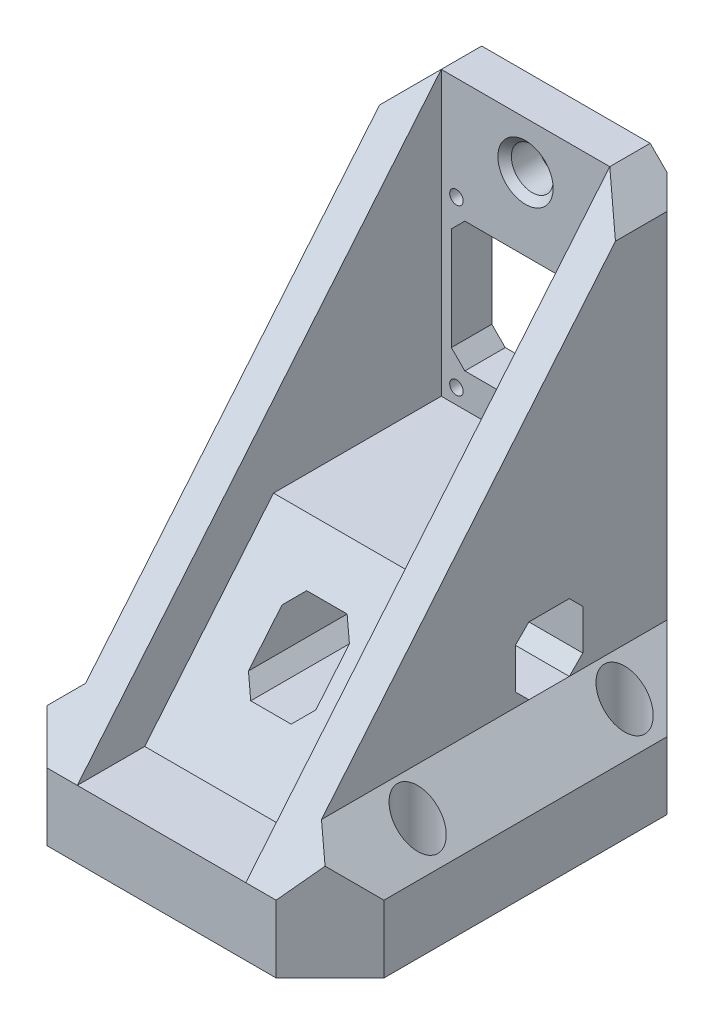
from build123d import *

# Parameters (mm, degrees)
SKETCH1_W           = 50
SKETCH1_H           = 60
BOSS_EXTRUDE1_DEPTH = 10
SKETCH2_R           = 1.5
CUT_EXTRUDE1_DEPTH  = 6
CUT_EXTRUDE2_REACH  = 41.509
SKETCH3_R           = 3
SKETCH5_W           = 25
SKETCH5_H           = 6
BOSS_EXTRUDE3_DEPTH = 65
CUT_EXTRUDE3_REACH  = 101.247
SKETCH6_W           = 22
SKETCH6_H           = 19.25
SKETCH7_R           = 1
CUT_EXTRUDE4_DEPTH  = 2.5
CUT_EXTRUDE5_REACH  = 99.171
SKETCH8_R           = 2
BOSS_EXTRUDE4_DEPTH = 5
CHAMFER1_SIZE       = 7.5
CHAMFER2_SIZE       = 10
CHAMFER4_SIZE       = 5.5
CHAMFER5_SIZE       = 5
CHAMFER7_SIZE       = 2
CUT_EXTRUDE6_REACH  = 101.247
SKETCH10_R          = 3.1
CHAMFER8_SIZE       = 1
BOSS_EXTRUDE5_REACH = 91.058
CHAMFER9_SIZE       = 8
CUT_EXTRUDE7_REACH  = 101.247
SKETCH12_W          = 10
SKETCH12_H          = 10
CUT_EXTRUDE9_REACH  = 88.168
SKETCH14_W          = 10
SKETCH14_H          = 10
CHAMFER11_SIZE      = 2


with BuildPart() as part:
    # Sketch1 → Boss-Extrude1 (new body)
    with BuildSketch(Plane(origin=(0, 0, 0), x_dir=(1, 0, 0), z_dir=(0, 1, 0))):
        Rectangle(SKETCH1_W, SKETCH1_H)
    extrude(amount=BOSS_EXTRUDE1_DEPTH)

    # Sketch2 → Cut-Extrude1 (cut)
    with BuildSketch(Plane(origin=(0, 0, 0), x_dir=(1, 0, 0), z_dir=(0, 1, 0))):
        with Locations(Location((-21, 17.7, 0), (0, 0, 270))):
            Circle(SKETCH2_R)
        with Locations(Location((-21, -13, 0), (0, 0, 270))):
            Circle(SKETCH2_R)
        with Locations(Location((21, 17.7, 0), (0, 0, 270))):
            Circle(SKETCH2_R)
        with Locations(Location((21, -13, 0), (0, 0, 270))):
            Circle(SKETCH2_R)
    extrude(amount=CUT_EXTRUDE1_DEPTH, mode=Mode.SUBTRACT)

    # Sketch3 → Cut-Extrude2 (cut, up to next)
    with BuildSketch(Plane.XZ.offset(-6), mode=Mode.PRIVATE) as cut_extrude2_sk1:
        with Locations(Location((-21, 13, 0), (0, 0, 270))):
            Circle(SKETCH3_R)
    cut_extrude2_tool1 = extrude(cut_extrude2_sk1.sketch, amount=-CUT_EXTRUDE2_REACH, mode=Mode.PRIVATE) & part.part
    # Sketch3 → Cut-Extrude2 (cut, up to next)
    with BuildSketch(Plane.XZ.offset(-6), mode=Mode.PRIVATE) as cut_extrude2_sk2:
        with Locations(Location((21, 13, 0), (0, 0, 270))):
            Circle(SKETCH3_R)
    cut_extrude2_tool2 = extrude(cut_extrude2_sk2.sketch, amount=-CUT_EXTRUDE2_REACH, mode=Mode.PRIVATE) & part.part
    # Sketch3 → Cut-Extrude2 (cut, up to next)
    with BuildSketch(Plane.XZ.offset(-6), mode=Mode.PRIVATE) as cut_extrude2_sk3:
        with Locations(Location((21, -17.7, 0), (0, 0, 270))):
            Circle(SKETCH3_R)
    cut_extrude2_tool3 = extrude(cut_extrude2_sk3.sketch, amount=-CUT_EXTRUDE2_REACH, mode=Mode.PRIVATE) & part.part
    # Sketch3 → Cut-Extrude2 (cut, up to next)
    with BuildSketch(Plane.XZ.offset(-6), mode=Mode.PRIVATE) as cut_extrude2_sk4:
        with Locations(Location((-21, -17.7, 0), (0, 0, 270))):
            Circle(SKETCH3_R)
    cut_extrude2_tool4 = extrude(cut_extrude2_sk4.sketch, amount=-CUT_EXTRUDE2_REACH, mode=Mode.PRIVATE) & part.part
    add(cut_extrude2_tool1.solids().sort_by_distance((-21, 6, 13))[0], mode=Mode.SUBTRACT)
    add(cut_extrude2_tool2.solids().sort_by_distance((21, 6, 13))[0], mode=Mode.SUBTRACT)
    add(cut_extrude2_tool3.solids().sort_by_distance((21, 6, -17.7))[0], mode=Mode.SUBTRACT)
    add(cut_extrude2_tool4.solids().sort_by_distance((-21, 6, -17.7))[0], mode=Mode.SUBTRACT)

    # Sketch5 → Boss-Extrude3 (add)
    with BuildSketch(Plane(origin=(0, 10, 0), x_dir=(1, 0, 0), z_dir=(0, 1, 0))):
        with Locations((0, 27)):
            Rectangle(SKETCH5_W, SKETCH5_H)
    extrude(amount=BOSS_EXTRUDE3_DEPTH)

    # Sketch6 → Cut-Extrude3 (cut, up to next)
    with BuildSketch(Plane(origin=(0, 0, -30), x_dir=(-1, 0, 0), z_dir=(0, 0, -1)), mode=Mode.PRIVATE) as cut_extrude3_sk1:
        with Locations((0, 47.625)):
            Rectangle(SKETCH6_W, SKETCH6_H)
    cut_extrude3_tool1 = extrude(cut_extrude3_sk1.sketch, amount=-CUT_EXTRUDE3_REACH, mode=Mode.PRIVATE) & part.part
    add(cut_extrude3_tool1.solids().sort_by_distance((0, 47.625, -30))[0], mode=Mode.SUBTRACT)

    # Sketch7 → Cut-Extrude4 (cut)
    with BuildSketch(Plane.XY.offset(-24)):
        with Locations((10.25, 35.25)):
            Circle(SKETCH7_R)
        with Locations((-10.25, 35.25)):
            Circle(SKETCH7_R)
        with Locations((-10.25, 59.7)):
            Circle(SKETCH7_R)
        with Locations((10.25, 59.7)):
            Circle(SKETCH7_R)
    extrude(amount=-CUT_EXTRUDE4_DEPTH, mode=Mode.SUBTRACT)

    # Sketch8 → Cut-Extrude5 (cut, up to next)
    with BuildSketch(Plane.XY.offset(-26.5), mode=Mode.PRIVATE) as cut_extrude5_sk1:
        with Locations((-10.25, 59.7)):
            Circle(SKETCH8_R)
    cut_extrude5_tool1 = extrude(cut_extrude5_sk1.sketch, amount=-CUT_EXTRUDE5_REACH, mode=Mode.PRIVATE) & part.part
    # Sketch8 → Cut-Extrude5 (cut, up to next)
    with BuildSketch(Plane.XY.offset(-26.5), mode=Mode.PRIVATE) as cut_extrude5_sk2:
        with Locations((10.25, 59.7)):
            Circle(SKETCH8_R)
    cut_extrude5_tool2 = extrude(cut_extrude5_sk2.sketch, amount=-CUT_EXTRUDE5_REACH, mode=Mode.PRIVATE) & part.part
    # Sketch8 → Cut-Extrude5 (cut, up to next)
    with BuildSketch(Plane.XY.offset(-26.5), mode=Mode.PRIVATE) as cut_extrude5_sk3:
        with Locations((10.25, 35.25)):
            Circle(SKETCH8_R)
    cut_extrude5_tool3 = extrude(cut_extrude5_sk3.sketch, amount=-CUT_EXTRUDE5_REACH, mode=Mode.PRIVATE) & part.part
    # Sketch8 → Cut-Extrude5 (cut, up to next)
    with BuildSketch(Plane.XY.offset(-26.5), mode=Mode.PRIVATE) as cut_extrude5_sk4:
        with Locations((-10.25, 35.25)):
            Circle(SKETCH8_R)
    cut_extrude5_tool4 = extrude(cut_extrude5_sk4.sketch, amount=-CUT_EXTRUDE5_REACH, mode=Mode.PRIVATE) & part.part
    add(cut_extrude5_tool1.solids().sort_by_distance((-10.25, 59.7, -26.5))[0], mode=Mode.SUBTRACT)
    add(cut_extrude5_tool2.solids().sort_by_distance((10.25, 59.7, -26.5))[0], mode=Mode.SUBTRACT)
    add(cut_extrude5_tool3.solids().sort_by_distance((10.25, 35.25, -26.5))[0], mode=Mode.SUBTRACT)
    add(cut_extrude5_tool4.solids().sort_by_distance((-10.25, 35.25, -26.5))[0], mode=Mode.SUBTRACT)

    # Sketch9 → Boss-Extrude4 (add)
    with BuildSketch(Plane(origin=(12.5, 0, 0), x_dir=(0, 0, -1), z_dir=(1, 0, 0))):
        Polygon((30, 75), (24, 75), (-30, 10), (30, 10), align=None)
    boss_extrude4 = extrude(amount=BOSS_EXTRUDE4_DEPTH)

    # Mirror1: Boss-Extrude4 across plane
    add(boss_extrude4.mirror(Plane(origin=(0, 0, 0), x_dir=(0, 0, 1), z_dir=(1, 0, 0))))

    # Chamfer1
    # the kernel refuses this chamfer: 7.5 mm, written as the material it adds along each edge
    with BuildSketch(Plane(origin=(17.5, 10, 30), x_dir=(0.9996219169112968, -0.02749587661058632, 0), z_dir=(0, 0, -1))) as chamfer1_piece_1_section:
        Polygon((CHAMFER1_SIZE * 0.999621916911, -CHAMFER1_SIZE * 0.0274958766106), (-CHAMFER1_SIZE * 0.0274958766106, -CHAMFER1_SIZE * 0.999621916911), (0, 0), align=None)
    chamfer1_piece_1 = extrude(amount=60, mode=Mode.PRIVATE)
    chamfer1_piece_1 = split(chamfer1_piece_1, bisect_by=Plane(origin=(19.919237696, 26.599778663, 16.209414649), z_dir=(0, -0.6390196945354667, -0.7691903730519506)), keep=Keep.TOP, mode=Mode.PRIVATE)
    chamfer1_piece_1 = chamfer1_piece_1 - Plane(origin=(21, 12.462621572, -17.7), x_dir=(0, 0, -1), z_dir=(0, -1, 0)) * Cylinder(3, 150, mode=Mode.PRIVATE)
    chamfer1_piece_1 = chamfer1_piece_1 - Plane(origin=(21, 12.462621572, 13), x_dir=(0, 0, -1), z_dir=(0, -1, 0)) * Cylinder(3, 150, mode=Mode.PRIVATE)
    chamfer1_piece_1 = split(chamfer1_piece_1, bisect_by=Plane(origin=(25, 12.462621572, -0.807533702), z_dir=(-1, 0, 0)), keep=Keep.TOP, mode=Mode.PRIVATE)
    add(chamfer1_piece_1)
    with BuildSketch(Plane(origin=(-17.5, 10, 30), x_dir=(0.02749587661058632, 0.9996219169112968, 0), z_dir=(0, 0, -1))) as chamfer1_piece_2_section:
        Polygon((CHAMFER1_SIZE * 0.999621916911, -CHAMFER1_SIZE * 0.0274958766106), (-CHAMFER1_SIZE * 0.0274958766106, -CHAMFER1_SIZE * 0.999621916911), (0, 0), align=None)
    chamfer1_piece_2 = extrude(amount=60, mode=Mode.PRIVATE)
    chamfer1_piece_2 = split(chamfer1_piece_2, bisect_by=Plane(origin=(-19.919241024, 26.599776134, 16.209416751), z_dir=(0, -0.6390196945354667, -0.7691903730519506)), keep=Keep.TOP, mode=Mode.PRIVATE)
    chamfer1_piece_2 = chamfer1_piece_2 - Plane(origin=(-21, 12.462621922, -17.7), x_dir=(0, 0, -1), z_dir=(0, -1, 0)) * Cylinder(3, 150, mode=Mode.PRIVATE)
    chamfer1_piece_2 = chamfer1_piece_2 - Plane(origin=(-21, 12.462621922, 13), x_dir=(0, 0, -1), z_dir=(0, -1, 0)) * Cylinder(3, 150, mode=Mode.PRIVATE)
    chamfer1_piece_2 = split(chamfer1_piece_2, bisect_by=Plane(origin=(-25, 12.462621922, -0.807528134), z_dir=(1, 0, 0)), keep=Keep.TOP, mode=Mode.PRIVATE)
    add(chamfer1_piece_2)

    # Chamfer2
    chamfer2_edges = [part.edges().sort_by_distance(p)[0] for p in [
        (-25, 5, -30),
        (25, 5, -30),
    ]]
    chamfer(chamfer2_edges, length=CHAMFER2_SIZE)

    # Chamfer4
    chamfer4_edges = [part.edges().sort_by_distance(p)[0] for p in [
        (0, 0, -30),
    ]]
    chamfer(chamfer4_edges, length=CHAMFER4_SIZE)

    # Chamfer5
    chamfer5_edges = [part.edges().sort_by_distance(p)[0] for p in [
        (17.5, 75, -25.75),
        (-17.5, 75, -25.75),
    ]]
    chamfer(chamfer5_edges, length=CHAMFER5_SIZE)

    # Chamfer7
    chamfer7_edges = [part.edges().sort_by_distance(p)[0] for p in [
        (-11, 57.25, -27),
        (-11, 38, -27),
        (11, 38, -27),
        (11, 57.25, -27),
    ]]
    chamfer(chamfer7_edges, length=CHAMFER7_SIZE)

    # Sketch10 → Cut-Extrude6 (cut, up to next)
    with BuildSketch(Plane(origin=(0, 0, -30), x_dir=(-1, 0, 0), z_dir=(0, 0, -1)), mode=Mode.PRIVATE) as cut_extrude6_sk1:
        with Locations((0, 68)):
            Circle(SKETCH10_R)
    cut_extrude6_tool1 = extrude(cut_extrude6_sk1.sketch, amount=-CUT_EXTRUDE6_REACH, mode=Mode.PRIVATE) & part.part
    add(cut_extrude6_tool1.solids().sort_by_distance((0, 68, -30))[0], mode=Mode.SUBTRACT)

    # Chamfer8
    chamfer8_edges = [part.edges().sort_by_distance(p)[0] for p in [
        (3.1, 68, -30),
        (3.1, 68, -24),
    ]]
    chamfer(chamfer8_edges, length=CHAMFER8_SIZE)

    # Sketch11 → Boss-Extrude5 (add, up to next)
    with BuildSketch(Plane(origin=(-12.5, 0, 0), x_dir=(0, 0, -1), z_dir=(1, 0, 0)), mode=Mode.PRIVATE) as boss_extrude5_sk1:
        Polygon((-20, 10), (24, 10), (24, 33), (-0.892307692, 33), align=None)
    boss_extrude5_tool1 = extrude(boss_extrude5_sk1.sketch, amount=BOSS_EXTRUDE5_REACH, mode=Mode.PRIVATE) - part.part
    add(boss_extrude5_tool1.solids().sort_by_distance((-12.5, 20.436802, -6.335287))[0])

    # Chamfer9
    chamfer9_edges = [part.edges().sort_by_distance(p)[0] for p in [
        (25, 5, 30),
        (-25, 5, 30),
    ]]
    chamfer(chamfer9_edges, length=CHAMFER9_SIZE)

    # Cut-Extrude7: up to this plane
    cut_extrude7_end = Plane(origin=(25.002, 33, 0.892307692), z_dir=(0, -0.6390196945354668, -0.7691903730519506))
    # Sketch12 → Cut-Extrude7 (cut, up to the surface)
    with BuildSketch(Plane(origin=(0, 0, -30), x_dir=(-1, 0, 0), z_dir=(0, 0, -1)), mode=Mode.PRIVATE) as cut_extrude7_sk1:
        with Locations((0, 22.5)):
            Rectangle(SKETCH12_W, SKETCH12_H)
    cut_extrude7_tool1 = split(extrude(cut_extrude7_sk1.sketch, amount=-CUT_EXTRUDE7_REACH, mode=Mode.PRIVATE), bisect_by=cut_extrude7_end, keep=Keep.BOTH, mode=Mode.PRIVATE)
    add(cut_extrude7_tool1.solids().sort_by_distance((0, 22.5, -30))[0], mode=Mode.SUBTRACT)

    # Sketch14 → Cut-Extrude9 (cut, up to next)
    with BuildSketch(Plane(origin=(-5, 0, 0), x_dir=(0, 0, -1), z_dir=(1, 0, 0)), mode=Mode.PRIVATE) as cut_extrude9_sk1:
        with Locations((10, 22.5)):
            Rectangle(SKETCH14_W, SKETCH14_H)
    cut_extrude9_tool1 = extrude(cut_extrude9_sk1.sketch, amount=-CUT_EXTRUDE9_REACH, mode=Mode.PRIVATE) & part.part
    cut_extrude9 = cut_extrude9_tool1.solids().sort_by_distance((-5, 22.5, -10))[0]
    add(cut_extrude9, mode=Mode.SUBTRACT)

    # Mirror2: Cut-Extrude9 across plane
    add(cut_extrude9.mirror(Plane(origin=(0, 0, 0), x_dir=(0, 0, 1), z_dir=(1, 0, 0))), mode=Mode.SUBTRACT)

    # Chamfer11
    chamfer11_edges = [part.edges().sort_by_distance(p)[0] for p in [
        (-5, 17.5, 4.384615385),
        (5, 17.5, 4.384615385),
        (5, 27.5, 0.230769231),
        (-5, 27.5, 0.230769231),
        (-5, 17.5, -22.5),
        (-5, 27.5, -22.5),
        (-11.25, 17.5, -15),
        (-11.25, 27.5, -15),
        (-11.25, 17.5, -5),
        (-11.25, 27.5, -5),
        (-5, 22.5, -15),
        (-5, 22.5, -5),
        (5, 27.5, -22.5),
        (5, 17.5, -22.5),
        (11.25, 17.5, -5),
        (11.25, 17.5, -15),
        (5, 22.5, -15),
        (11.25, 27.5, -15),
        (11.25, 27.5, -5),
        (5, 22.5, -5),
    ]]
    chamfer(chamfer11_edges, length=CHAMFER11_SIZE)


solid = part.part
